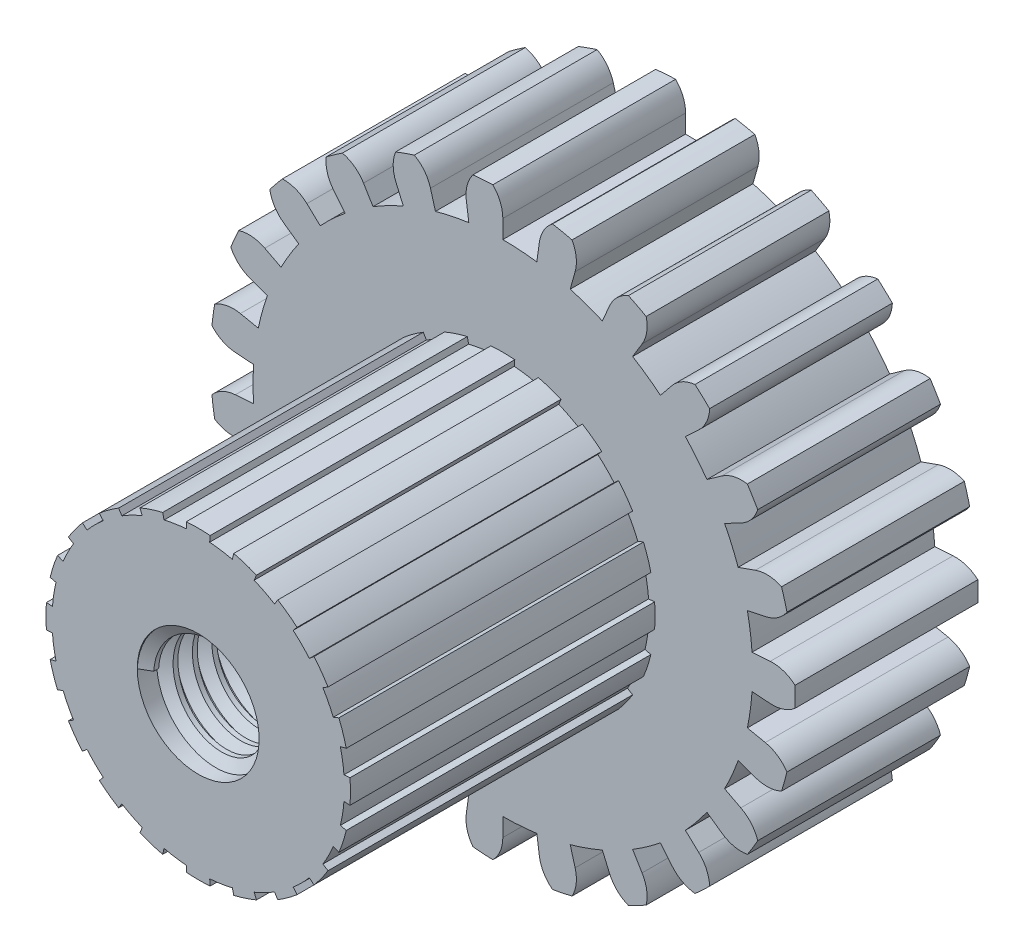
from build123d import *

# Parameters (mm, degrees)
BOSS_EXTRUDE1_DEPTH = 3
SKETCH2_R           = 1
BOSS_EXTRUDE2_DEPTH = 5
THREAD1_PITCH       = 0.3175
CUT_EXTRUDE1_DEPTH  = 3


with BuildPart() as part:
    # Sketch1 → Boss-Extrude1 (new body)
    with BuildSketch(Plane.XY):
        with BuildLine():
            Line((4.090442166, 0.279790791), (4.389742812, 0.300263288))
            ThreePointArc((4.389742812, 0.300263288), (4.606987301, 0.272445538), (4.79720177, 0.163875509))
            ThreePointArc((4.79720177, 0.163875509), (4.8, 0), (4.79720177, -0.163875509))
            ThreePointArc((4.79720177, -0.163875509), (4.606987301, -0.272445538), (4.389742812, -0.300263288))
            Line((4.389742812, -0.300263288), (4.090442166, -0.279790791))
            ThreePointArc((4.090442166, -0.279790791), (4.078505002, -0.419281463), (4.061812379, -0.558283261))
            ThreePointArc((4.061812379, -0.558283261), (4.040383758, -0.696634112), (4.014244126, -0.8341727))
            Line((4.014244126, -0.8341727), (4.307969306, -0.895209726))
            ThreePointArc((4.307969306, -0.895209726), (4.509652642, -0.98060778), (4.663521598, -1.136470988))
            ThreePointArc((4.663521598, -1.136470988), (4.622002979, -1.295024502), (4.575095432, -1.452068108))
            ThreePointArc((4.575095432, -1.452068108), (4.362642789, -1.505292817), (4.145949175, -1.473467147))
            Line((4.145949175, -1.473467147), (3.863270823, -1.373003478))
            ThreePointArc((3.863270823, -1.373003478), (3.814142188, -1.50410085), (3.760566336, -1.633444468))
            ThreePointArc((3.760566336, -1.633444468), (3.702605734, -1.760883521), (3.640327964, -1.886269417))
            Line((3.640327964, -1.886269417), (3.906693425, -2.024289131))
            ThreePointArc((3.906693425, -2.024289131), (4.077857676, -2.160933905), (4.183969364, -2.35253063))
            ThreePointArc((4.183969364, -2.35253063), (4.101213142, -2.49400296), (4.013675195, -2.632567459))
            ThreePointArc((4.013675195, -2.632567459), (3.794741018, -2.626499415), (3.594669455, -2.53739069))
            Line((3.594669455, -2.53739069), (3.349578356, -2.364386779))
            ThreePointArc((3.349578356, -2.364386779), (3.266901897, -2.477367958), (3.180416292, -2.587460572))
            ThreePointArc((3.180416292, -2.587460572), (3.090222381, -2.694536256), (2.99642533, -2.798470161))
            Line((2.99642533, -2.798470161), (3.215675964, -3.00323627))
            ThreePointArc((3.215675964, -3.00323627), (3.343626661, -3.180993448), (3.394111262, -3.394113837))
            ThreePointArc((3.394111262, -3.394113837), (3.276255087, -3.508012629), (3.154579031, -3.617821325))
            ThreePointArc((3.154579031, -3.617821325), (2.945400666, -3.552910565), (2.776789545, -3.413127572))
            Line((2.776789545, -3.413127572), (2.587462985, -3.180414328))
            ThreePointArc((2.587462985, -3.180414328), (2.477370437, -3.266900017), (2.364389321, -3.349576561))
            ThreePointArc((2.364389321, -3.349576561), (2.248651371, -3.428347563), (2.130291537, -3.503121175))
            Line((2.130291537, -3.503121175), (2.286166527, -3.759447115))
            ThreePointArc((2.286166527, -3.759447115), (2.361414153, -3.965133259), (2.352527455, -4.183971149))
            ThreePointArc((2.352527455, -4.183971149), (2.208312181, -4.261849048), (2.061522171, -4.334757933))
            ThreePointArc((2.061522171, -4.334757933), (1.87761342, -4.215818593), (1.752967858, -4.035728396))
            Line((1.752967858, -4.035728396), (1.633447322, -3.760565097))
            ThreePointArc((1.633447322, -3.760565097), (1.504103744, -3.814141047), (1.37300641, -3.863269781))
            ThreePointArc((1.37300641, -3.863269781), (1.240308176, -3.907894015), (1.106163766, -3.947961718))
            Line((1.106163766, -3.947961718), (1.187102578, -4.236836965))
            ThreePointArc((1.187102578, -4.236836965), (1.20406636, -4.455197276), (1.136467449, -4.66352246))
            ThreePointArc((1.136467449, -4.66352246), (0.976588863, -4.699603621), (0.815571643, -4.730205376))
            ThreePointArc((0.815571643, -4.730205376), (0.670572177, -4.566058642), (0.599136564, -4.359017708))
            Line((0.599136564, -4.359017708), (0.558286344, -4.061811955))
            ThreePointArc((0.558286344, -4.061811955), (0.419284558, -4.078504684), (0.279793895, -4.090441954))
            ThreePointArc((0.279793895, -4.090441954), (0.139976997, -4.097609845), (-3.111e-06, -4.1))
            Line((-3.111e-06, -4.1), (-3.339e-06, -4.4))
            ThreePointArc((-3.339e-06, -4.4), (-0.042581527, -4.614839692), (-0.163879149, -4.797201645))
            ThreePointArc((-0.163879149, -4.797201645), (-0.327563584, -4.788810092), (-0.490866103, -4.774835125))
            ThreePointArc((-0.490866103, -4.774835125), (-0.586202337, -4.57765501), (-0.599129948, -4.359018617))
            Line((-0.599129948, -4.359018617), (-0.558280179, -4.061812802))
            ThreePointArc((-0.558280179, -4.061812802), (-0.696631046, -4.040384287), (-0.834169654, -4.014244759))
            ThreePointArc((-0.834169654, -4.014244759), (-0.970735635, -3.983424698), (-1.106169758, -3.947960039))
            Line((-1.106169758, -3.947960039), (-1.187109008, -4.236835164))
            ThreePointArc((-1.187109008, -4.236835164), (-1.286071337, -4.432220559), (-1.45207158, -4.57509433))
            ThreePointArc((-1.45207158, -4.57509433), (-1.607422138, -4.522852426), (-1.760898556, -4.465337196))
            ThreePointArc((-1.760898556, -4.465337196), (-1.799500905, -4.249747647), (-1.752961733, -4.035731057))
            Line((-1.752961733, -4.035731057), (-1.633441615, -3.760567576))
            ThreePointArc((-1.633441615, -3.760567576), (-1.760880712, -3.702607071), (-1.886266655, -3.640329395))
            ThreePointArc((-1.886266655, -3.640329395), (-2.009453246, -3.573807165), (-2.130296853, -3.503117942))
            Line((-2.130296853, -3.503117942), (-2.286172233, -3.759443645))
            ThreePointArc((-2.286172233, -3.759443645), (-2.434179119, -3.920883904), (-2.632570505, -4.013673198))
            ThreePointArc((-2.632570505, -4.013673198), (-2.768065546, -3.921455486), (-2.900333219, -3.824665635))
            ThreePointArc((-2.900333219, -3.824665635), (-2.879338723, -3.606655942), (-2.776784365, -3.413131786))
            Line((-2.776784365, -3.413131786), (-2.587458158, -3.180418255))
            ThreePointArc((-2.587458158, -3.180418255), (-2.694533911, -3.090224426), (-2.798467887, -2.996427454))
            ThreePointArc((-2.798467887, -2.996427454), (-2.899138903, -2.899136703), (-2.996429577, -2.798465613))
            Line((-2.996429577, -2.798465613), (-3.215680522, -3.00323139))
            ThreePointArc((-3.215680522, -3.00323139), (-3.401754971, -3.118753226), (-3.617823718, -3.154576286))
            ThreePointArc((-3.617823718, -3.154576286), (-3.723414195, -3.029222133), (-3.824663434, -2.900336121))
            ThreePointArc((-3.824663434, -2.900336121), (-3.745629161, -2.696075065), (-3.594665604, -2.537396145))
            Line((-3.594665604, -2.537396145), (-3.349574767, -2.364391862))
            ThreePointArc((-3.349574767, -2.364391862), (-3.428345856, -2.248653973), (-3.503119559, -2.130294195))
            ThreePointArc((-3.503119559, -2.130294195), (-3.57380869, -2.009450534), (-3.640330827, -1.886263892))
            Line((-3.640330827, -1.886263892), (-3.906696497, -2.024283201))
            ThreePointArc((-3.906696497, -2.024283201), (-4.117038219, -2.085318889), (-4.334759497, -2.061518882))
            ThreePointArc((-4.334759497, -2.061518882), (-4.402614247, -1.912325231), (-4.46533586, -1.760901945))
            ThreePointArc((-4.46533586, -1.760901945), (-4.334123418, -1.585538635), (-4.145946939, -1.47347344))
            Line((-4.145946939, -1.47347344), (-3.863268739, -1.373009341))
            ThreePointArc((-3.863268739, -1.373009341), (-3.907893073, -1.240311141), (-3.947960878, -1.106166762))
            ThreePointArc((-3.947960878, -1.106166762), (-3.983425435, -0.970732613), (-4.014245392, -0.834166607))
            Line((-4.014245392, -0.834166607), (-4.307970665, -0.895203188))
            ThreePointArc((-4.307970665, -0.895203188), (-4.526979577, -0.897225989), (-4.730205994, -0.815568053))
            ThreePointArc((-4.730205994, -0.815568053), (-4.755292541, -0.653599916), (-4.774834752, -0.490869727))
            ThreePointArc((-4.774834752, -0.490869727), (-4.601175569, -0.357410057), (-4.389742357, -0.30026995))
            Line((-4.389742357, -0.30026995), (-4.090441741, -0.279796999))
            ThreePointArc((-4.090441741, -0.279796999), (-4.097609739, -0.139980106), (-4.1, 0))
            ThreePointArc((-4.1, 0), (-4.097609739, 0.139980106), (-4.090441741, 0.279796999))
            Line((-4.090441741, 0.279796999), (-4.389742357, 0.30026995))
            ThreePointArc((-4.389742357, 0.30026995), (-4.601175569, 0.357410057), (-4.774834752, 0.490869727))
            ThreePointArc((-4.774834752, 0.490869727), (-4.755292541, 0.653599916), (-4.730205994, 0.815568053))
            ThreePointArc((-4.730205994, 0.815568053), (-4.526979577, 0.897225989), (-4.307970665, 0.895203188))
            Line((-4.307970665, 0.895203188), (-4.014245392, 0.834166607))
            ThreePointArc((-4.014245392, 0.834166607), (-3.983425435, 0.970732613), (-3.947960878, 1.106166762))
            ThreePointArc((-3.947960878, 1.106166762), (-3.907893073, 1.240311141), (-3.863268739, 1.373009341))
            Line((-3.863268739, 1.373009341), (-4.145946939, 1.47347344))
            ThreePointArc((-4.145946939, 1.47347344), (-4.334123418, 1.585538635), (-4.46533586, 1.760901945))
            ThreePointArc((-4.46533586, 1.760901945), (-4.402614247, 1.912325231), (-4.334759497, 2.061518882))
            ThreePointArc((-4.334759497, 2.061518882), (-4.117038219, 2.085318889), (-3.906696497, 2.024283201))
            Line((-3.906696497, 2.024283201), (-3.640330827, 1.886263892))
            ThreePointArc((-3.640330827, 1.886263892), (-3.57380869, 2.009450534), (-3.503119559, 2.130294195))
            ThreePointArc((-3.503119559, 2.130294195), (-3.428345856, 2.248653973), (-3.349574767, 2.364391862))
            Line((-3.349574767, 2.364391862), (-3.594665604, 2.537396145))
            ThreePointArc((-3.594665604, 2.537396145), (-3.745629161, 2.696075065), (-3.824663434, 2.900336121))
            ThreePointArc((-3.824663434, 2.900336121), (-3.723414195, 3.029222133), (-3.617823718, 3.154576286))
            ThreePointArc((-3.617823718, 3.154576286), (-3.401754971, 3.118753226), (-3.215680522, 3.00323139))
            Line((-3.215680522, 3.00323139), (-2.996429577, 2.798465613))
            ThreePointArc((-2.996429577, 2.798465613), (-2.899138903, 2.899136703), (-2.798467887, 2.996427454))
            ThreePointArc((-2.798467887, 2.996427454), (-2.694533911, 3.090224426), (-2.587458158, 3.180418255))
            Line((-2.587458158, 3.180418255), (-2.776784365, 3.413131786))
            ThreePointArc((-2.776784365, 3.413131786), (-2.879338723, 3.606655942), (-2.900333219, 3.824665635))
            ThreePointArc((-2.900333219, 3.824665635), (-2.768065546, 3.921455486), (-2.632570505, 4.013673198))
            ThreePointArc((-2.632570505, 4.013673198), (-2.434179119, 3.920883904), (-2.286172233, 3.759443645))
            Line((-2.286172233, 3.759443645), (-2.130296853, 3.503117942))
            ThreePointArc((-2.130296853, 3.503117942), (-2.009453246, 3.573807165), (-1.886266655, 3.640329395))
            ThreePointArc((-1.886266655, 3.640329395), (-1.760880712, 3.702607071), (-1.633441615, 3.760567576))
            Line((-1.633441615, 3.760567576), (-1.752961733, 4.035731057))
            ThreePointArc((-1.752961733, 4.035731057), (-1.799500905, 4.249747647), (-1.760898556, 4.465337196))
            ThreePointArc((-1.760898556, 4.465337196), (-1.607422138, 4.522852426), (-1.45207158, 4.57509433))
            ThreePointArc((-1.45207158, 4.57509433), (-1.286071337, 4.432220559), (-1.187109008, 4.236835164))
            Line((-1.187109008, 4.236835164), (-1.106169758, 3.947960039))
            ThreePointArc((-1.106169758, 3.947960039), (-0.970735635, 3.983424698), (-0.834169654, 4.014244759))
            ThreePointArc((-0.834169654, 4.014244759), (-0.696631046, 4.040384287), (-0.558280179, 4.061812802))
            Line((-0.558280179, 4.061812802), (-0.599129948, 4.359018617))
            ThreePointArc((-0.599129948, 4.359018617), (-0.586202337, 4.57765501), (-0.490866103, 4.774835125))
            ThreePointArc((-0.490866103, 4.774835125), (-0.327563584, 4.788810092), (-0.163879149, 4.797201645))
            ThreePointArc((-0.163879149, 4.797201645), (-0.042581527, 4.614839692), (-3.339e-06, 4.4))
            Line((-3.339e-06, 4.4), (-3.111e-06, 4.1))
            ThreePointArc((-3.111e-06, 4.1), (0.139976997, 4.097609845), (0.279793895, 4.090441954))
            ThreePointArc((0.279793895, 4.090441954), (0.419284558, 4.078504684), (0.558286344, 4.061811955))
            Line((0.558286344, 4.061811955), (0.599136564, 4.359017708))
            ThreePointArc((0.599136564, 4.359017708), (0.670572177, 4.566058642), (0.815571643, 4.730205376))
            ThreePointArc((0.815571643, 4.730205376), (0.976588863, 4.699603621), (1.136467449, 4.66352246))
            ThreePointArc((1.136467449, 4.66352246), (1.20406636, 4.455197276), (1.187102578, 4.236836965))
            Line((1.187102578, 4.236836965), (1.106163766, 3.947961718))
            ThreePointArc((1.106163766, 3.947961718), (1.240308176, 3.907894015), (1.37300641, 3.863269781))
            ThreePointArc((1.37300641, 3.863269781), (1.504103744, 3.814141047), (1.633447322, 3.760565097))
            Line((1.633447322, 3.760565097), (1.752967858, 4.035728396))
            ThreePointArc((1.752967858, 4.035728396), (1.87761342, 4.215818593), (2.061522171, 4.334757933))
            ThreePointArc((2.061522171, 4.334757933), (2.208312181, 4.261849048), (2.352527455, 4.183971149))
            ThreePointArc((2.352527455, 4.183971149), (2.361414153, 3.965133259), (2.286166527, 3.759447115))
            Line((2.286166527, 3.759447115), (2.130291537, 3.503121175))
            ThreePointArc((2.130291537, 3.503121175), (2.248651371, 3.428347563), (2.364389321, 3.349576561))
            ThreePointArc((2.364389321, 3.349576561), (2.477370437, 3.266900017), (2.587462985, 3.180414328))
            Line((2.587462985, 3.180414328), (2.776789545, 3.413127572))
            ThreePointArc((2.776789545, 3.413127572), (2.945400666, 3.552910565), (3.154579031, 3.617821325))
            ThreePointArc((3.154579031, 3.617821325), (3.276255087, 3.508012629), (3.394111262, 3.394113837))
            ThreePointArc((3.394111262, 3.394113837), (3.343626661, 3.180993448), (3.215675964, 3.00323627))
            Line((3.215675964, 3.00323627), (2.99642533, 2.798470161))
            ThreePointArc((2.99642533, 2.798470161), (3.090222381, 2.694536256), (3.180416292, 2.587460572))
            ThreePointArc((3.180416292, 2.587460572), (3.266901897, 2.477367958), (3.349578356, 2.364386779))
            Line((3.349578356, 2.364386779), (3.594669455, 2.53739069))
            ThreePointArc((3.594669455, 2.53739069), (3.794741018, 2.626499415), (4.013675195, 2.632567459))
            ThreePointArc((4.013675195, 2.632567459), (4.101213142, 2.49400296), (4.183969364, 2.35253063))
            ThreePointArc((4.183969364, 2.35253063), (4.077857676, 2.160933905), (3.906693425, 2.024289131))
            Line((3.906693425, 2.024289131), (3.640327964, 1.886269417))
            ThreePointArc((3.640327964, 1.886269417), (3.702605734, 1.760883521), (3.760566336, 1.633444468))
            ThreePointArc((3.760566336, 1.633444468), (3.814142188, 1.50410085), (3.863270823, 1.373003478))
            Line((3.863270823, 1.373003478), (4.145949175, 1.473467147))
            ThreePointArc((4.145949175, 1.473467147), (4.362642789, 1.505292817), (4.575095432, 1.452068108))
            ThreePointArc((4.575095432, 1.452068108), (4.622002979, 1.295024502), (4.663521598, 1.136470988))
            ThreePointArc((4.663521598, 1.136470988), (4.509652642, 0.98060778), (4.307969306, 0.895209726))
            Line((4.307969306, 0.895209726), (4.014244126, 0.8341727))
            ThreePointArc((4.014244126, 0.8341727), (4.040383758, 0.696634112), (4.061812379, 0.558283261))
            ThreePointArc((4.061812379, 0.558283261), (4.078505002, 0.419281463), (4.090442166, 0.279790791))
        make_face()
    extrude(amount=BOSS_EXTRUDE1_DEPTH)

    # Sketch2 → Boss-Extrude2 (add)
    with BuildSketch(Plane.XY.offset(3)):
        with BuildLine():
            Line((2.392601601, 0.18830183), (2.491434518, 0.196080149))
            ThreePointArc((2.491434518, 0.196080149), (2.499138528, 0), (2.491434518, -0.196080149))
            Line((2.491434518, -0.196080149), (2.392601601, -0.18830183))
            ThreePointArc((2.392601601, -0.18830183), (2.383364297, -0.282089754), (2.370452017, -0.375442716))
            ThreePointArc((2.370452017, -0.375442716), (2.353884673, -0.468216773), (2.333687809, -0.560268873))
            Line((2.333687809, -0.560268873), (2.430087131, -0.583412303))
            ThreePointArc((2.430087131, -0.583412303), (2.376821982, -0.772276276), (2.308902935, -0.95637891))
            Line((2.308902935, -0.95637891), (2.217310878, -0.918440238))
            ThreePointArc((2.217310878, -0.918440238), (2.179543617, -1.00478337), (2.138415658, -1.089577199))
            ThreePointArc((2.138415658, -1.089577199), (2.093990417, -1.17269098), (2.046336394, -1.253996555))
            Line((2.046336394, -1.253996555), (2.130865885, -1.305796294))
            ThreePointArc((2.130865885, -1.305796294), (2.02184554, -1.46895677), (1.900359845, -1.623060639))
            Line((1.900359845, -1.623060639), (1.824974317, -1.558675316))
            ThreePointArc((1.824974317, -1.558675316), (1.762374023, -1.629121789), (1.697056275, -1.697056275))
            ThreePointArc((1.697056275, -1.697056275), (1.629121789, -1.762374023), (1.558675316, -1.824974317))
            Line((1.558675316, -1.824974317), (1.623060639, -1.900359845))
            ThreePointArc((1.623060639, -1.900359845), (1.46895677, -2.02184554), (1.305796294, -2.130865885))
            Line((1.305796294, -2.130865885), (1.253996555, -2.046336394))
            ThreePointArc((1.253996555, -2.046336394), (1.17269098, -2.093990417), (1.089577199, -2.138415658))
            ThreePointArc((1.089577199, -2.138415658), (1.00478337, -2.179543617), (0.918440238, -2.217310878))
            Line((0.918440238, -2.217310878), (0.95637891, -2.308902935))
            ThreePointArc((0.95637891, -2.308902935), (0.772276276, -2.376821982), (0.583412303, -2.430087131))
            Line((0.583412303, -2.430087131), (0.560268873, -2.333687809))
            ThreePointArc((0.560268873, -2.333687809), (0.468216773, -2.353884673), (0.375442716, -2.370452017))
            ThreePointArc((0.375442716, -2.370452017), (0.282089754, -2.383364297), (0.18830183, -2.392601601))
            Line((0.18830183, -2.392601601), (0.196080149, -2.491434518))
            ThreePointArc((0.196080149, -2.491434518), (0, -2.499138528), (-0.196080149, -2.491434518))
            Line((-0.196080149, -2.491434518), (-0.18830183, -2.392601601))
            ThreePointArc((-0.18830183, -2.392601601), (-0.282089754, -2.383364297), (-0.375442716, -2.370452017))
            ThreePointArc((-0.375442716, -2.370452017), (-0.468216773, -2.353884673), (-0.560268873, -2.333687809))
            Line((-0.560268873, -2.333687809), (-0.583412303, -2.430087131))
            ThreePointArc((-0.583412303, -2.430087131), (-0.772276276, -2.376821982), (-0.95637891, -2.308902935))
            Line((-0.95637891, -2.308902935), (-0.918440238, -2.217310878))
            ThreePointArc((-0.918440238, -2.217310878), (-1.00478337, -2.179543617), (-1.089577199, -2.138415658))
            ThreePointArc((-1.089577199, -2.138415658), (-1.17269098, -2.093990417), (-1.253996555, -2.046336394))
            Line((-1.253996555, -2.046336394), (-1.305796294, -2.130865885))
            ThreePointArc((-1.305796294, -2.130865885), (-1.46895677, -2.02184554), (-1.623060639, -1.900359845))
            Line((-1.623060639, -1.900359845), (-1.558675316, -1.824974317))
            ThreePointArc((-1.558675316, -1.824974317), (-1.629121789, -1.762374023), (-1.697056275, -1.697056275))
            ThreePointArc((-1.697056275, -1.697056275), (-1.762374023, -1.629121789), (-1.824974317, -1.558675316))
            Line((-1.824974317, -1.558675316), (-1.900359845, -1.623060639))
            ThreePointArc((-1.900359845, -1.623060639), (-2.02184554, -1.46895677), (-2.130865885, -1.305796294))
            Line((-2.130865885, -1.305796294), (-2.046336394, -1.253996555))
            ThreePointArc((-2.046336394, -1.253996555), (-2.093990417, -1.17269098), (-2.138415658, -1.089577199))
            ThreePointArc((-2.138415658, -1.089577199), (-2.179543617, -1.00478337), (-2.217310878, -0.918440238))
            Line((-2.217310878, -0.918440238), (-2.308902935, -0.95637891))
            ThreePointArc((-2.308902935, -0.95637891), (-2.376821982, -0.772276276), (-2.430087131, -0.583412303))
            Line((-2.430087131, -0.583412303), (-2.333687809, -0.560268873))
            ThreePointArc((-2.333687809, -0.560268873), (-2.353884673, -0.468216773), (-2.370452017, -0.375442716))
            ThreePointArc((-2.370452017, -0.375442716), (-2.383364297, -0.282089754), (-2.392601601, -0.18830183))
            Line((-2.392601601, -0.18830183), (-2.491434518, -0.196080149))
            ThreePointArc((-2.491434518, -0.196080149), (-2.499138528, 0), (-2.491434518, 0.196080149))
            Line((-2.491434518, 0.196080149), (-2.392601601, 0.18830183))
            ThreePointArc((-2.392601601, 0.18830183), (-2.383364297, 0.282089754), (-2.370452017, 0.375442716))
            ThreePointArc((-2.370452017, 0.375442716), (-2.353884673, 0.468216773), (-2.333687809, 0.560268873))
            Line((-2.333687809, 0.560268873), (-2.430087131, 0.583412303))
            ThreePointArc((-2.430087131, 0.583412303), (-2.376821982, 0.772276276), (-2.308902935, 0.95637891))
            Line((-2.308902935, 0.95637891), (-2.217310878, 0.918440238))
            ThreePointArc((-2.217310878, 0.918440238), (-2.179543617, 1.00478337), (-2.138415658, 1.089577199))
            ThreePointArc((-2.138415658, 1.089577199), (-2.093990417, 1.17269098), (-2.046336394, 1.253996555))
            Line((-2.046336394, 1.253996555), (-2.130865885, 1.305796294))
            ThreePointArc((-2.130865885, 1.305796294), (-2.02184554, 1.46895677), (-1.900359845, 1.623060639))
            Line((-1.900359845, 1.623060639), (-1.824974317, 1.558675316))
            ThreePointArc((-1.824974317, 1.558675316), (-1.762374023, 1.629121789), (-1.697056275, 1.697056275))
            ThreePointArc((-1.697056275, 1.697056275), (-1.629121789, 1.762374023), (-1.558675316, 1.824974317))
            Line((-1.558675316, 1.824974317), (-1.623060639, 1.900359845))
            ThreePointArc((-1.623060639, 1.900359845), (-1.46895677, 2.02184554), (-1.305796294, 2.130865885))
            Line((-1.305796294, 2.130865885), (-1.253996555, 2.046336394))
            ThreePointArc((-1.253996555, 2.046336394), (-1.17269098, 2.093990417), (-1.089577199, 2.138415658))
            ThreePointArc((-1.089577199, 2.138415658), (-1.00478337, 2.179543617), (-0.918440238, 2.217310878))
            Line((-0.918440238, 2.217310878), (-0.95637891, 2.308902935))
            ThreePointArc((-0.95637891, 2.308902935), (-0.772276276, 2.376821982), (-0.583412303, 2.430087131))
            Line((-0.583412303, 2.430087131), (-0.560268873, 2.333687809))
            ThreePointArc((-0.560268873, 2.333687809), (-0.468216773, 2.353884673), (-0.375442716, 2.370452017))
            ThreePointArc((-0.375442716, 2.370452017), (-0.282089754, 2.383364297), (-0.18830183, 2.392601601))
            Line((-0.18830183, 2.392601601), (-0.196080149, 2.491434518))
            ThreePointArc((-0.196080149, 2.491434518), (0, 2.499138528), (0.196080149, 2.491434518))
            Line((0.196080149, 2.491434518), (0.18830183, 2.392601601))
            ThreePointArc((0.18830183, 2.392601601), (0.282089754, 2.383364297), (0.375442716, 2.370452017))
            ThreePointArc((0.375442716, 2.370452017), (0.468216773, 2.353884673), (0.560268873, 2.333687809))
            Line((0.560268873, 2.333687809), (0.583412303, 2.430087131))
            ThreePointArc((0.583412303, 2.430087131), (0.772276276, 2.376821982), (0.95637891, 2.308902935))
            Line((0.95637891, 2.308902935), (0.918440238, 2.217310878))
            ThreePointArc((0.918440238, 2.217310878), (1.00478337, 2.179543617), (1.089577199, 2.138415658))
            ThreePointArc((1.089577199, 2.138415658), (1.17269098, 2.093990417), (1.253996555, 2.046336394))
            Line((1.253996555, 2.046336394), (1.305796294, 2.130865885))
            ThreePointArc((1.305796294, 2.130865885), (1.46895677, 2.02184554), (1.623060639, 1.900359845))
            Line((1.623060639, 1.900359845), (1.558675316, 1.824974317))
            ThreePointArc((1.558675316, 1.824974317), (1.629121789, 1.762374023), (1.697056275, 1.697056275))
            ThreePointArc((1.697056275, 1.697056275), (1.762374023, 1.629121789), (1.824974317, 1.558675316))
            Line((1.824974317, 1.558675316), (1.900359845, 1.623060639))
            ThreePointArc((1.900359845, 1.623060639), (2.02184554, 1.46895677), (2.130865885, 1.305796294))
            Line((2.130865885, 1.305796294), (2.046336394, 1.253996555))
            ThreePointArc((2.046336394, 1.253996555), (2.093990417, 1.17269098), (2.138415658, 1.089577199))
            ThreePointArc((2.138415658, 1.089577199), (2.179543617, 1.00478337), (2.217310878, 0.918440238))
            Line((2.217310878, 0.918440238), (2.308902935, 0.95637891))
            ThreePointArc((2.308902935, 0.95637891), (2.376821982, 0.772276276), (2.430087131, 0.583412303))
            Line((2.430087131, 0.583412303), (2.333687809, 0.560268873))
            ThreePointArc((2.333687809, 0.560268873), (2.353884673, 0.468216773), (2.370452017, 0.375442716))
            ThreePointArc((2.370452017, 0.375442716), (2.383364297, 0.282089754), (2.392601601, 0.18830183))
        make_face()
        Circle(SKETCH2_R, mode=Mode.SUBTRACT)
    extrude(amount=BOSS_EXTRUDE2_DEPTH)

    # Thread1: the profile of Thread Profile1 profile screwed along a right-hand helix of 15.748031 turns, 6 arcs to a turn; built about Z, then put on its axis
    thread1_z = Axis((0, 0, 0), (0, 0, 1))
    thread1_corners = [(1.0003, 0, -0.000173205), (1.0003, 0, 0.277985704), (0.828148085, 0, 0.17859375), (0.828148085, 0, 0.09921875)]
    with BuildLine(mode=Mode.PRIVATE) as thread1_profile:
        Line(thread1_corners[0], thread1_corners[1])
        Line(thread1_corners[1], thread1_corners[2])
        Line(thread1_corners[2], thread1_corners[3])
        Line(thread1_corners[3], thread1_corners[0])
    thread1_cap = Face(thread1_profile.wire())
    thread1_turn_angles = [0, 30, 60, 90, 120, 150, 180, 210, 240, 270, 300, 330, 360]
    thread1_turn_weights = [1, 0.8660254037844387, 1, 0.8660254037844387, 1, 0.8660254037844387, 1, 0.8660254037844387, 1, 0.8660254037844387, 1, 0.8660254037844387, 1]
    thread1_turn_rails = [Edge.make_bspline([Vector(p[0], p[1], 0).rotate(thread1_z, thread1_turn_angles[k]) / thread1_turn_weights[k] + Vector(0, 0, p[2] + THREAD1_PITCH * thread1_turn_angles[k] / 360) for k in range(13)], [0, 0, 0, 1, 1, 2, 2, 3, 3, 4, 4, 5, 5, 6, 6, 6], 2, thread1_turn_weights) for p in thread1_corners]
    thread1_turn_sides = [Face.make_surface_from_curves(thread1_turn_rails[p[0]], thread1_turn_rails[p[1]]) for p in [(0, 1), (1, 2), (2, 3), (3, 0)]]
    thread1_last_angles = [5400, 5430, 5460, 5490, 5520, 5550, 5580, 5610, 5640, 5654.645669291, 5669.291338583]
    thread1_last_weights = [1, 0.8660254037844387, 1, 0.8660254037844387, 1, 0.8660254037844387, 1, 0.8660254037844387, 1, 0.9675079437748935, 1]
    thread1_last_rails = [Edge.make_bspline([Vector(p[0], p[1], 0).rotate(thread1_z, thread1_last_angles[k]) / thread1_last_weights[k] + Vector(0, 0, p[2] + THREAD1_PITCH * thread1_last_angles[k] / 360) for k in range(11)], [0, 0, 0, 1, 1, 2, 2, 3, 3, 4, 4, 5, 5, 5], 2, thread1_last_weights) for p in thread1_corners]
    thread1_last_sides = [Face.make_surface_from_curves(thread1_last_rails[p[0]], thread1_last_rails[p[1]]) for p in [(0, 1), (1, 2), (2, 3), (3, 0)]]
    thread1 = Plane(origin=(0, 0, 8), x_dir=(-1, 0, 0), z_dir=(0, 0, -1)) * Solid(Shell([*[p.moved(Location((0, 0, THREAD1_PITCH * i))) for i in range(15) for p in thread1_turn_sides], *thread1_last_sides, thread1_cap, thread1_cap.rotate(thread1_z, 5669.291338583).moved(Location((0, 0, THREAD1_PITCH * 5669.291338583 / 360)))]))
    add(thread1)

    # Sketch5 → Cut-Extrude1 (cut)
    with BuildSketch(Plane(origin=(0, 0, 0), x_dir=(-1, 0, 0), z_dir=(0, 0, -1))):
        with BuildLine():
            Line((0.35, 0.547722558), (0.35, -0.547722558))
            ThreePointArc((0.35, -0.547722558), (-0.65, 0), (0.35, 0.547722558))
        make_face()
    extrude(amount=-CUT_EXTRUDE1_DEPTH, mode=Mode.SUBTRACT)


solid = part.part
